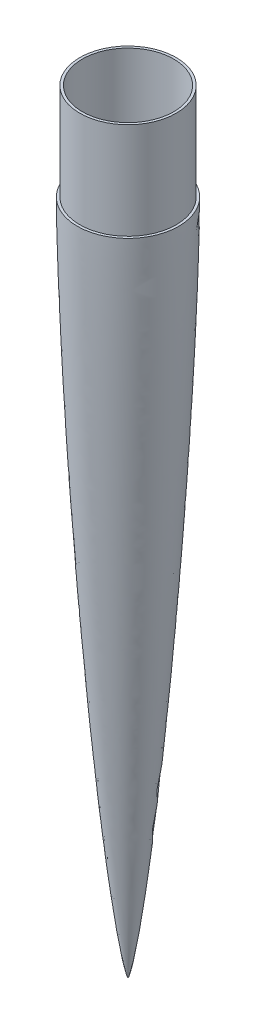
from build123d import *


with BuildPart() as part:
    # Sketch1 → Revolve2 (revolve)
    with BuildSketch(Plane.XY):
        with BuildLine():
            Line((-60, 0), (-57.03, 0))
            Line((-57.03, 0), (-57.03, 114.3))
            Line((-57.03, 114.3), (-54.06, 114.3))
            Line((-54.06, 114.3), (-54.06, 0))
            Line((-54.06, 0), (-54.976899673, -95.267420725))
            add(Edge.make_bspline(
                [(-54.976899673, -95.267420725), (-54.937419093, -96.498478321), (-54.364062076, -114.226866512), (-53.113695417, -148.450334505), (-50.275970445, -214.422054543), (-46.024079239, -296.858704348), (-40.929694814, -379.24641803), (-36.336675618, -445.121102942), (-32.617977144, -494.507030381), (-28.60130755, -543.867289658), (-24.246866318, -593.195799193), (-19.489249783, -642.482041326), (-15.096442555, -683.503613679), (-11.204083921, -716.265940368), (-8.031012796, -740.798446569), (-5.083321372, -761.179327839), (-2.399174813, -777.413847893), (-0.856722542, -785.443876764), (0, -789.4471984)],
                knots=[0.118780128, 0.118780128, 0.118780128, 0.118780128, 0.123383649, 0.185075474, 0.246767298, 0.370150947, 0.493534596, 0.555226421, 0.616918245, 0.67861007, 0.740301894, 0.801993719, 0.863685543, 0.894531456, 0.925377368, 0.95622328, 0.971646236, 0.987069192, 0.987069192, 0.987069192, 0.987069192], degree=3))
            Line((0, -789.4471984), (0, -800))
            add(Edge.make_bspline(
                [(-60, 0), (-60, -0.801301824), (-59.992858014, -2.134935758), (-59.98048707, -4.395895866), (-59.96251556, -6.544624516), (-59.942761818, -8.749908515), (-59.919055681, -10.925483501), (-59.894059366, -13.116761755), (-59.866178739, -15.299547638), (-59.836621265, -17.48683519), (-59.80514679, -19.671667321), (-59.771541464, -21.858055356), (-59.736867908, -24.043503346), (-59.700043709, -26.229650559), (-59.66204493, -28.41526885), (-59.622459621, -30.601327879), (-59.581547217, -32.787003018), (-59.538995019, -34.972696398), (-59.495607768, -37.158385038), (-59.450302943, -39.34406904), (-59.404469233, -41.530099826), (-59.356787893, -43.715780933), (-59.308588023, -45.901808333), (-59.258630434, -48.087490165), (-59.208100543, -50.273187043), (-59.155819313, -52.458864623), (-59.103495156, -54.644569067), (-59.048276425, -56.830561965), (-58.994274985, -59.016276927), (-58.938221442, -61.202296633), (-58.881140769, -63.387981946), (-58.823355443, -65.574008856), (-58.764379524, -67.759688478), (-58.704665809, -69.945374772), (-58.643925455, -72.131063874), (-58.582319142, -74.316753088), (-58.519674699, -76.502771688), (-58.456509605, -78.688463984), (-58.392124534, -80.874483057), (-58.327106119, -83.060179384), (-58.261198982, -85.245982329), (-58.194209713, -87.431660434), (-58.127297802, -89.61736007), (-58.058647275, -91.803260902), (-57.989251169, -93.988944863), (-57.919504151, -96.174974634), (-57.848643133, -98.360657974), (-57.777245448, -100.546676496), (-57.705052501, -102.732368286), (-57.607762905, -105.646864011), (-57.508846665, -108.561004505), (-57.408627348, -111.475463532), (-57.332851064, -113.661158289), (-57.256046683, -115.847173485), (-57.179035511, -118.032871552), (-57.100710846, -120.218547193), (-57.022009698, -122.40423276), (-56.942857414, -124.589926107), (-56.862296371, -126.775926431), (-56.782243077, -128.96164674), (-56.699699005, -131.147635149), (-56.618336347, -133.333360228), (-56.535453881, -135.519371841), (-56.452132799, -137.705058585), (-56.367953748, -139.890737929), (-56.283265361, -142.076429794), (-56.198014609, -144.262121161), (-56.111932015, -146.448137697), (-56.025500016, -148.633833532), (-55.937916927, -150.819842926), (-55.850276009, -153.005543945), (-55.76134219, -155.191213723), (-55.643051191, -158.105392465), (-55.522717339, -161.019854888), (-55.401601937, -163.934321952), (-55.309872078, -166.120335129), (-55.218077571, -168.306038315), (-55.124824644, -170.492033851), (-55.032082371, -172.677748721), (-54.937643698, -174.863408092), (-54.843635874, -177.049121618), (-54.748038186, -179.234791682), (-54.652569374, -181.420836883), (-54.556479629, -183.606533338), (-54.459475917, -185.792547103), (-54.362188819, -187.978234727), (-54.264269964, -190.163924556), (-54.165587671, -192.349599766), (-54.066616508, -194.535290959), (-53.966784555, -196.721302604), (-53.866693946, -198.906999552), (-53.765933643, -201.093026138), (-53.664741488, -203.278718394), (-53.562574071, -205.464729689), (-53.46015287, -207.650414823), (-53.357451076, -209.836114668), (-53.25379016, -212.021793327), (-53.149897537, -214.207484038), (-53.045189805, -216.393500975), (-52.939966643, -218.579191869), (-52.834346122, -220.765225661), (-52.72802674, -222.95090942), (-52.621553387, -225.136604178), (-52.513848545, -227.32227415), (-52.40670358, -229.508001007), (-52.297171846, -231.693961127), (-52.189930067, -233.879735673), (-52.079082133, -236.065676373), (-51.969910846, -238.251412967), (-51.85901638, -240.437401634), (-51.748265493, -242.623099873), (-51.636731103, -244.808784209), (-51.524563121, -246.994461643), (-51.41233969, -249.180169949), (-51.298859713, -251.366169958), (-51.185781728, -253.551885484), (-51.071121402, -255.737881493), (-50.956939094, -257.923591641), (-50.841400016, -260.109265018), (-50.726212458, -262.29498087), (-50.609806822, -264.480661757), (-50.493089081, -266.666677341), (-50.376072117, -268.852372888), (-50.2582093, -271.038380358), (-50.140185668, -273.224081487), (-50.021331093, -275.409964495), (-49.902264979, -277.595663351), (-49.782525036, -279.781345211), (-49.662222809, -281.96715596), (-49.541568082, -284.152841674), (-49.420204402, -286.338856279), (-49.298798343, -288.524573428), (-49.175813178, -290.710555166), (-49.054627888, -292.896341283), (-48.929555275, -295.081919321), (-48.80703709, -297.267689436), (-48.682200389, -299.453344602), (-48.557622575, -301.63937574), (-48.432377267, -303.825065531), (-48.306604755, -306.011076632), (-48.138301508, -308.925568974), (-47.968757752, -311.840024396), (-47.798650693, -314.754161782), (-47.670344167, -316.939847051), (-47.541698169, -319.125548351), (-47.41222605, -321.311556797), (-47.282518137, -323.497255833), (-47.152537397, -325.68329376), (-47.021571672, -327.868970857), (-46.890540884, -330.05467291), (-46.758438058, -332.240330723), (-46.626631093, -334.426034491), (-46.493724324, -336.612038639), (-46.360537695, -338.797731393), (-46.226723482, -340.983758972), (-46.092732037, -343.169463313), (-45.957681737, -345.355362203), (-45.822817454, -347.541074097), (-45.686540199, -349.726720561), (-45.551343277, -351.912568316), (-45.413978364, -354.098210705), (-45.27660323, -356.284223198), (-45.139053758, -358.469936355), (-45.000763617, -360.655955619), (-44.862039539, -362.841656073), (-44.722923977, -365.027353453), (-44.582999362, -367.21302593), (-44.44309759, -369.398736621), (-44.301914301, -371.584719331), (-44.160935543, -373.770425312), (-44.019209139, -375.956439275), (-43.876769511, -378.142115164), (-43.734218837, -380.327899792), (-43.590938835, -382.513586347), (-43.447088585, -384.69926936), (-43.302846381, -386.885214629), (-43.158036869, -389.070907079), (-43.012913506, -391.256947279), (-42.866890616, -393.442611195), (-42.720711356, -395.628637303), (-42.573798549, -397.814315117), (-42.426490997, -400.000021171), (-42.278628488, -402.185713002), (-42.130254761, -404.371392804), (-41.981568615, -406.557429677), (-41.831681394, -408.743075027), (-41.682828376, -410.92916822), (-41.531510493, -413.114784676), (-41.330439397, -416.029298352), (-41.128056223, -418.943436932), (-40.924663592, -421.857882421), (-40.771744547, -424.043579315), (-40.618076428, -426.22959461), (-40.464009097, -428.415295234), (-40.309205215, -430.601315556), (-40.154312127, -432.787028349), (-39.99863944, -434.972710046), (-39.842152913, -437.158365607), (-39.685814825, -439.344094129), (-39.52808724, -441.530081544), (-39.370694913, -443.715806359), (-39.211862327, -445.901785529), (-39.053403335, -448.087522124), (-38.893639517, -450.273297547), (-38.733738096, -452.458987048), (-38.573226107, -454.644664914), (-38.41208941, -456.830568481), (-38.250643552, -459.016289263), (-38.088118005, -461.202280635), (-37.925733991, -463.388006805), (-37.762033172, -465.573994828), (-37.597960177, -467.759671106), (-37.434333947, -469.945406433), (-37.268766086, -472.131043433), (-37.103624375, -474.316764751), (-36.937277162, -476.502778388), (-36.770677476, -478.688464011), (-36.603339409, -480.874477936), (-36.435566057, -483.06017656), (-36.267208758, -485.245881682), (-36.098010633, -487.431559843), (-35.928747445, -489.617272102), (-35.758303916, -491.803273105), (-35.587725669, -493.988973654), (-35.416406694, -496.17499239), (-35.24443382, -498.360674999), (-35.072049117, -500.546710875), (-34.898922146, -502.732404615), (-34.667151047, -505.646902354), (-34.434568289, -508.561067682), (-34.200313769, -511.475477223), (-34.024304915, -513.661157965), (-33.847353496, -515.847147357), (-33.670779824, -518.032918232), (-33.491732112, -520.21866423), (-33.313572689, -522.404386438), (-33.13423745, -524.590066145), (-32.954158609, -526.775947698), (-32.774006064, -528.961669566), (-32.592404739, -531.147650911), (-32.410922159, -533.333354764), (-32.228195825, -535.51936234), (-32.045138628, -537.705064649), (-31.861206713, -539.890749257), (-31.67668942, -542.076440099), (-31.491950547, -544.262152097), (-31.30592436, -546.448161538), (-31.119329898, -548.633846995), (-30.932322619, -550.819875434), (-30.744507905, -553.005570214), (-30.555977806, -555.191260582), (-30.36652527, -557.376929049), (-30.177192953, -559.562665124), (-29.985666111, -561.748602994), (-29.794943847, -563.93436667), (-29.602713105, -566.120357514), (-29.409925868, -568.306050437), (-29.216509259, -570.492084484), (-29.02205264, -572.677756942), (-28.827321473, -574.863463769), (-28.631319546, -577.049111422), (-28.435242486, -579.234842067), (-28.237450587, -581.420811966), (-28.039775325, -583.606534105), (-27.840828887, -585.792549196), (-27.641363771, -587.978245938), (-27.441068518, -590.163943402), (-27.239817856, -592.349628243), (-27.0380143, -594.535347519), (-26.834843959, -596.721325459), (-26.631931269, -598.907071959), (-26.426637245, -601.092994458), (-26.222215448, -603.278758694), (-26.015644194, -605.4647156), (-25.808938096, -607.650420412), (-25.601048983, -609.836107743), (-25.392425955, -612.021819265), (-25.182943681, -614.207535647), (-24.972300709, -616.393547963), (-24.761180821, -618.579245775), (-24.54873058, -620.765243183), (-24.335610494, -622.950940724), (-24.121675392, -625.136655174), (-23.906299598, -627.322305823), (-23.690750483, -629.508036765), (-23.473088531, -631.693979902), (-23.256298117, -633.8797989), (-23.036339334, -636.065712517), (-22.816790067, -638.251465366), (-22.595568041, -640.437451396), (-22.37382784, -642.623161306), (-22.150636061, -644.808818844), (-21.926517879, -646.99450118), (-21.701733241, -649.180231976), (-21.474931493, -651.36619235), (-21.248017068, -653.551943093), (-21.019029725, -655.737918981), (-20.789829622, -657.923669499), (-20.481575316, -660.838186303), (-20.17186238, -663.752385107), (-19.859263751, -666.666750242), (-19.623758946, -668.852440953), (-19.386668524, -671.038438197), (-19.148621967, -673.224159459), (-18.908853728, -675.410154942), (-18.668383585, -677.595878389), (-18.4259741, -679.781542734), (-18.18254924, -681.967245551), (-17.937557318, -684.152919888), (-17.691134791, -686.338934942), (-17.360468135, -689.253500161), (-17.027092261, -692.168023287), (-16.690290755, -695.082034686), (-16.436360122, -697.267741079), (-16.180582016, -699.453414347), (-15.923153165, -701.639444446), (-15.663726888, -703.825109315), (-15.403283369, -706.011193549), (-15.140251016, -708.196818551), (-14.787701284, -711.111483586), (-14.431043936, -714.02561342), (-14.070483242, -716.939962247), (-13.797649101, -719.125616294), (-13.523200412, -721.311687751), (-13.246358405, -723.497375359), (-12.966968973, -725.683380179), (-12.685478788, -727.869068213), (-12.401707374, -730.054788832), (-12.11485921, -732.240449989), (-11.826077725, -734.426228793), (-11.533519555, -736.612177986), (-11.239618062, -738.797990862), (-10.941229851, -740.983889436), (-10.641035051, -743.169674773), (-10.336774322, -745.355680174), (-10.029395087, -747.541377644), (-9.718851509, -749.727131227), (-9.404000449, -751.912794778), (-9.08556711, -754.098530416), (-8.762685057, -756.284514591), (-8.436077124, -758.470302477), (-8.103829106, -760.656249808), (-7.767502801, -762.84203593), (-7.425345054, -765.027744196), (-7.077547468, -767.213468373), (-6.723634326, -769.399204772), (-6.362870612, -771.58529517), (-5.995180963, -773.771115527), (-5.618456723, -775.957155147), (-5.23402258, -778.143043949), (-4.837473721, -780.328947788), (-4.432755981, -782.515156226), (-4.009246187, -784.70065055), (-3.579266776, -786.887635552), (-3.113726927, -789.072377108), (-2.655958759, -791.262251237), (-2.107505569, -793.444196948), (-1.628649729, -795.6455355), (-0.840672324, -797.841494526), (-0.582426643, -799.351899399), (0, -800)],
                knots=[0, 0, 0, 0, 0.002721315, 0.005443895, 0.008165279, 0.010887941, 0.013609388, 0.016332111, 0.019053617, 0.021775487, 0.024497974, 0.0272196, 0.029942492, 0.03266416, 0.035387117, 0.038108852, 0.04083186, 0.043553666, 0.046275496, 0.048998614, 0.051720527, 0.054443713, 0.057165667, 0.05988892, 0.062610956, 0.065333013, 0.068056339, 0.070778475, 0.073501855, 0.076224025, 0.078947511, 0.081669751, 0.084393271, 0.087115584, 0.089837927, 0.092561566, 0.095283969, 0.098007652, 0.100730126, 0.103453879, 0.106176423, 0.108899388, 0.11162279, 0.114345403, 0.117069304, 0.119792003, 0.122515947, 0.125238701, 0.127962718, 0.130685546, 0.136132527, 0.138855426, 0.141579611, 0.144302595, 0.147026824, 0.149749851, 0.15247292, 0.155197234, 0.157920346, 0.160644746, 0.163367944, 0.166092386, 0.168815634, 0.171540127, 0.174263426, 0.176986776, 0.179711393, 0.182434776, 0.185159464, 0.187882937, 0.190607665, 0.193331212, 0.196054764, 0.201503213, 0.204228129, 0.206951815, 0.209676745, 0.212400514, 0.215125513, 0.217849317, 0.220573138, 0.22329827, 0.226022159, 0.228747349, 0.231471296, 0.234196523, 0.23692055, 0.239644613, 0.24236992, 0.245094057, 0.247819466, 0.250543645, 0.253269127, 0.255993366, 0.258718906, 0.261443215, 0.264167557, 0.266893186, 0.269617579, 0.272343283, 0.275067784, 0.277793528, 0.280518047, 0.283242615, 0.285968485, 0.288693112, 0.291418982, 0.294143732, 0.296869661, 0.29959444, 0.302320472, 0.305045289, 0.307770171, 0.310496302, 0.313221247, 0.315947465, 0.318672457, 0.321398759, 0.324123818, 0.326848941, 0.329575331, 0.3323005, 0.335026935, 0.337752191, 0.340478691, 0.343204014, 0.345930114, 0.348655969, 0.351381361, 0.354108055, 0.35683351, 0.359560274, 0.362285861, 0.365012625, 0.367738286, 0.370463914, 0.373190851, 0.375916585, 0.378643563, 0.381369371, 0.384096423, 0.389549442, 0.392275386, 0.395001377, 0.397728625, 0.400454703, 0.403182024, 0.405908168, 0.408635572, 0.411361766, 0.414088017, 0.416815493, 0.419541792, 0.422269409, 0.424995782, 0.427723473, 0.43044992, 0.433177256, 0.435904206, 0.438630727, 0.441358565, 0.444085241, 0.44681316, 0.449539919, 0.452267919, 0.454994756, 0.457721599, 0.460449704, 0.463176679, 0.465904847, 0.468631871, 0.471360177, 0.474087261, 0.476814716, 0.479542836, 0.482270046, 0.484998573, 0.487725891, 0.490454473, 0.493181817, 0.495910524, 0.498637988, 0.501365534, 0.504094322, 0.506821867, 0.509550818, 0.512278446, 0.515007397, 0.517735195, 0.523192122, 0.525920017, 0.528649229, 0.531377241, 0.534106519, 0.536834668, 0.539564066, 0.542292224, 0.545020465, 0.547749983, 0.550478375, 0.553207951, 0.555936403, 0.558666126, 0.561394697, 0.564123645, 0.566853084, 0.569581775, 0.572311733, 0.575040571, 0.577770563, 0.580499491, 0.58322966, 0.585958588, 0.588687613, 0.591417977, 0.594147099, 0.59687756, 0.599606779, 0.602337336, 0.605066749, 0.607796162, 0.610526865, 0.613256424, 0.615987255, 0.61871688, 0.621447837, 0.624177605, 0.626908668, 0.629638566, 0.635099741, 0.637829799, 0.640561099, 0.643291255, 0.646022749, 0.648753107, 0.651483929, 0.654215066, 0.656945629, 0.659677437, 0.662408005, 0.665139987, 0.667870727, 0.670602815, 0.673333763, 0.676064713, 0.678797008, 0.681528102, 0.684260567, 0.686991831, 0.689724335, 0.692455808, 0.695187282, 0.697919996, 0.700651678, 0.703384602, 0.706116397, 0.708849432, 0.711581437, 0.714314712, 0.717046752, 0.719778976, 0.722512462, 0.725244836, 0.727978528, 0.73071105, 0.733444946, 0.736177626, 0.738910432, 0.741644603, 0.744377596, 0.747111829, 0.749845046, 0.752579504, 0.755312842, 0.758047546, 0.760781117, 0.763514816, 0.766249873, 0.768983774, 0.771718989, 0.774453048, 0.777188544, 0.779922883, 0.782657299, 0.785393079, 0.788127774, 0.79086375, 0.793598736, 0.79633496, 0.799070192, 0.801806681, 0.804542081, 0.807277673, 0.810014608, 0.812750444, 0.815487662, 0.818223866, 0.820961325, 0.823697799, 0.829172385, 0.831909259, 0.834647506, 0.837384785, 0.840123438, 0.842861051, 0.845600047, 0.848337974, 0.851076155, 0.853815708, 0.85655416, 0.859294194, 0.864773562, 0.867513015, 0.870252618, 0.872993689, 0.875733808, 0.87847545, 0.881216006, 0.883958151, 0.886699258, 0.892183762, 0.894925773, 0.897669472, 0.900412093, 0.903156424, 0.905899836, 0.908644843, 0.911388992, 0.914133617, 0.916879848, 0.919625411, 0.922372539, 0.925118931, 0.927867054, 0.930614637, 0.933363972, 0.936112571, 0.938862009, 0.941613254, 0.944364078, 0.947116858, 0.949869369, 0.952623961, 0.955378461, 0.958133964, 0.960891978, 0.963650065, 0.96641106, 0.969172296, 0.971936857, 0.974702286, 0.977471382, 0.980242909, 0.983017954, 0.985798888, 0.988584911, 0.991380795, 0.994189294, 0.997024962, 1, 1, 1, 1], degree=3))
        make_face()
    revolve(axis=Axis((0, -789.4471984, 0), (0, 1, 0)))


solid = part.part
